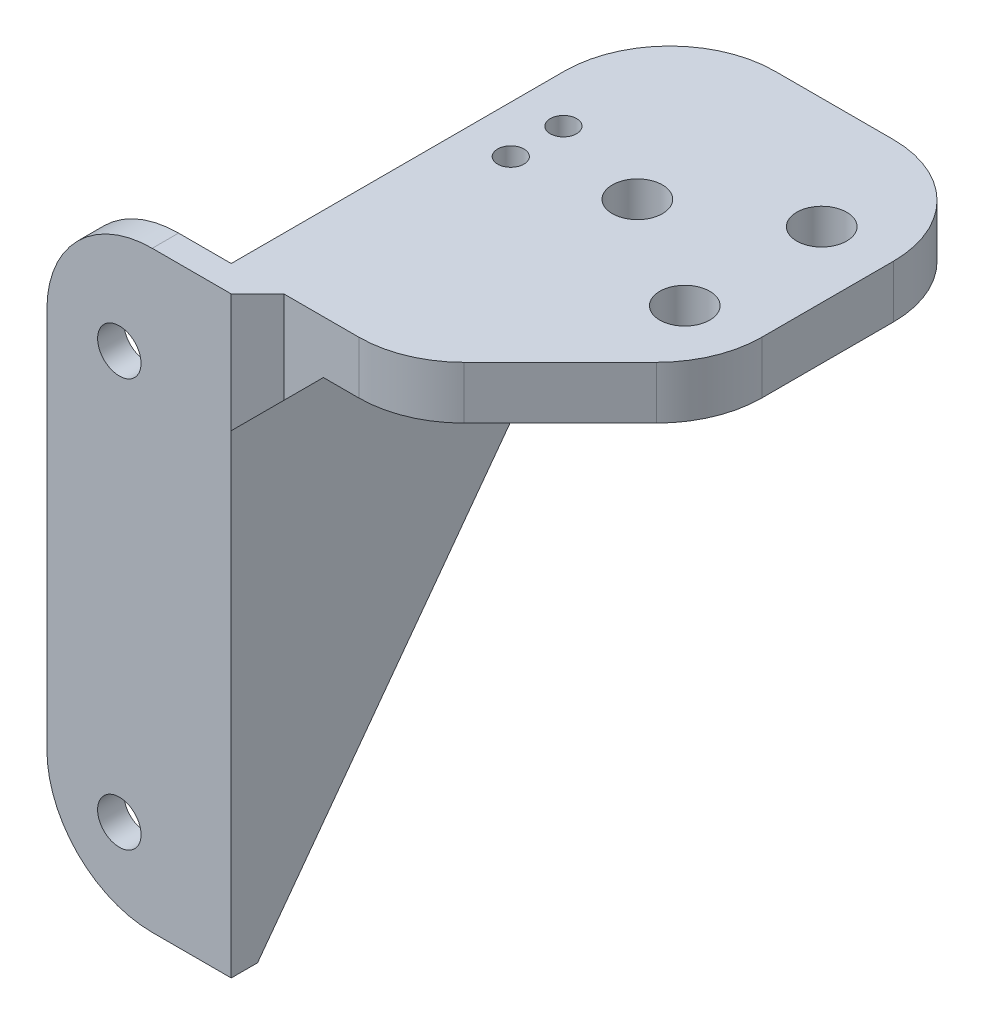
from build123d import *

# Parameters (mm, degrees)
SKETCH1_R           = 1.6500000000000001
SKETCH1_R_2         = 1.6500000000000006
BOSS_EXTRUDE1_DEPTH = 2
BOSS_EXTRUDE2_DEPTH = 2
BOSS_EXTRUDE3_DEPTH = 4
SKETCH4_R           = 1.8999999999999948
SKETCH4_R_2         = 1.8999999999999981
CUT_EXTRUDE1_DEPTH  = 4
SKETCH5_R           = 1.0000000000000009
SKETCH5_R_2         = 1
SKETCH5_R_3         = 1.8999999999999981
CUT_EXTRUDE2_DEPTH  = 63.418667079648536
CUT_EXTRUDE3_DEPTH  = 4
CHAMFER1_SIZE       = 5
CHAMFER2_SIZE       = 2
FILLET1_R           = 8
FILLET2_R           = 8
FILLET3_R           = 8


# Some blends are built 0.0001 mm under size
with BuildPart() as part:
    # Sketch1 → Boss-Extrude1 (new body)
    with BuildSketch(Plane.XY):
        Polygon((0, 0), (-12, -1.47e-15), (-12, 45), (0, 45), align=None)
        with Locations((-6.499999999999999, 37)):
            Circle(SKETCH1_R, mode=Mode.SUBTRACT)
        with Locations((-6.5000000000000036, 5.999999999999999)):
            Circle(SKETCH1_R_2, mode=Mode.SUBTRACT)
    extrude(amount=-BOSS_EXTRUDE1_DEPTH)

    # Sketch2 → Boss-Extrude2 (add)
    with BuildSketch(Plane(origin=(0, 0, 0), x_dir=(0, 0, -1), z_dir=(1, 0, 0))):
        Polygon((35.3, 45), (2, 0), (5.51e-15, 0), (0, 45), align=None)
    extrude(amount=BOSS_EXTRUDE2_DEPTH)

    # Sketch3 → Boss-Extrude3 (add)
    with BuildSketch(Plane(origin=(0, 45, 0), x_dir=(1, 0, 0), z_dir=(0, 1, 0))):
        Polygon((-6.1e-16, 35.3), (25, 35.3), (25.000000000000004, 1.9999999999999991), (3.47e-15, 1.9999999999999991), align=None)
    extrude(amount=-BOSS_EXTRUDE3_DEPTH)

    # Sketch4 → Cut-Extrude1 (cut)
    with BuildSketch(Plane(origin=(0, 45, 0), x_dir=(1, 0, 0), z_dir=(0, 1, 0))):
        with Locations(Location((20.000000000000004, 26.850000000000005, 0), (0, 0, 270))):
            Circle(SKETCH4_R)
        with Locations(Location((20.00000000000001, 16.45, 0), (0, 0, 270))):
            Circle(SKETCH4_R)
        with Locations(Location((11.200000000000008, 21.650000000000002, 0), (0, 0, 270))):
            Circle(SKETCH4_R_2)
    extrude(amount=-CUT_EXTRUDE1_DEPTH, mode=Mode.SUBTRACT)

    # Sketch5 → Cut-Extrude2 (cut, through all)
    with BuildSketch(Plane(origin=(0, 45, 0), x_dir=(1, 0, 0), z_dir=(0, 1, 0))):
        with Locations(Location((3.5826389249908894, 23.65, 0), (0, 0, 270))):
            Circle(SKETCH5_R)
        with Locations(Location((3.5826389249908894, 19.650000000000002, 0), (0, 0, 270))):
            Circle(SKETCH5_R_2)
        with Locations(Location((11.200000000000008, 21.650000000000002, 0), (0, 0, 270))):
            Circle(SKETCH5_R_3)
    extrude(amount=-CUT_EXTRUDE2_DEPTH, mode=Mode.SUBTRACT)

    # Sketch6 → Cut-Extrude3 (cut)
    with BuildSketch(Plane(origin=(0, 45, 0), x_dir=(1, 0, 0), z_dir=(0, 1, 0))):
        Polygon((13.000000000000005, 1.9999999999999991), (25.000000000000004, 13.999999999999877), (25.000000000000004, 1.9999999999999991), align=None)
    extrude(amount=-CUT_EXTRUDE3_DEPTH, mode=Mode.SUBTRACT)

    # Chamfer1
    # the kernel refuses this chamfer: 5 mm, written as the material it adds along each edge
    with BuildSketch(Plane(origin=(2, 41, -45.19841493982955), x_dir=(-0.02749587661058636, -0.9996219169112968, 0), z_dir=(0, 0, 1))) as chamfer1_piece_1_section:
        Polygon((CHAMFER1_SIZE * 0.999621916911, CHAMFER1_SIZE * 0.0274958766106), (-CHAMFER1_SIZE * 0.0274958766106, CHAMFER1_SIZE * 0.999621916911), (0, 0), align=None)
    chamfer1_piece_1 = extrude(amount=43.19841493982955, mode=Mode.PRIVATE)
    chamfer1_piece_1 = split(chamfer1_piece_1, bisect_by=Plane(origin=(3.679771833975431, 32.284665683470884, -25.89065260576845), z_dir=(0, 0.5948430054102947, 0.8038418992031009)), keep=Keep.TOP, mode=Mode.PRIVATE)
    chamfer1_piece_1 = chamfer1_piece_1 - Plane(origin=(3.5826389249908894, 39.396771086693036, -19.650000000000002), x_dir=(-1.8e-16, 0, 1), z_dir=(0, 1, 0)) * Cylinder(1, 107, mode=Mode.PRIVATE)
    chamfer1_piece_1 = chamfer1_piece_1 - Plane(origin=(3.5826389249908894, 39.396771086693036, -23.65), x_dir=(-1.8e-16, 0, 1), z_dir=(0, 1, 0)) * Cylinder(1.0000000000000009, 107, mode=Mode.PRIVATE)
    add(chamfer1_piece_1)

    # Chamfer2
    chamfer2_edges = [part.edges().sort_by_distance(p)[0] for p in [
        (1.9999999999990004, 40.50000000000074, -1.9999999999999996),
    ]]
    chamfer(chamfer2_edges, length=CHAMFER2_SIZE - 0.0001)  # a hair under: the kernel refuses the full size

    # Fillet1
    fillet1_edges = [part.edges().sort_by_distance(p)[0] for p in [
        (-12, -1.47e-15, -1),
        (-12, 45, -1),
    ]]
    fillet(fillet1_edges, radius=FILLET1_R)

    # Fillet2
    fillet2_edges = [part.edges().sort_by_distance(p)[0] for p in [
        (-6.1e-16, 43, -35.3),
        (25, 43, -35.3),
    ]]
    fillet(fillet2_edges, radius=FILLET2_R)

    # Fillet3
    fillet3_edges = [part.edges().sort_by_distance(p)[0] for p in [
        (13.000000000000005, 43, -1.9999999999999991),
        (25.000000000000004, 43, -13.999999999999877),
    ]]
    fillet(fillet3_edges, radius=FILLET3_R)


solid = part.part
